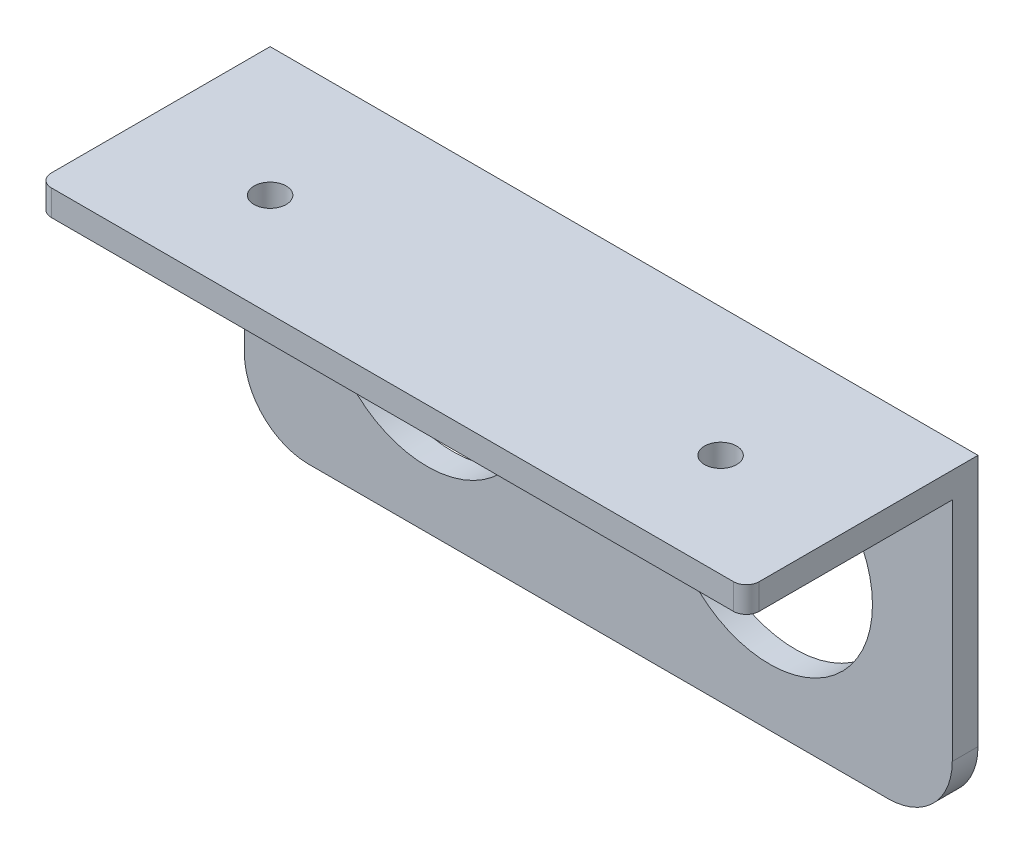
from build123d import *

# Parameters (mm, degrees)
SKETCH1_W             = 55
SKETCH1_H             = 22.6
BOSS_EXTRUDE1_DEPTH   = 2
SKETCH2_R             = 8
CUT_EXTRUDE2_DEPTH    = 2
SKETCH2_4_R           = 8
CUT_EXTRUDE3_DEPTH    = 2
SKETCH5_W             = 10
SKETCH5_H             = 4.7
CUT_EXTRUDE4_DEPTH    = 2
SKETCH6_W             = 55
SKETCH6_H             = 2
BOSS_EXTRUDE2_DEPTH   = 18
M3X0_5_TAPPED_HOLE1_D = 2.5
M3X0_5_TAPPED_HOLE2_D = 2.5
FILLET1_R             = 5
FILLET2_R             = 5
FILLET4_R             = 1.8
FILLET5_R             = 1.8
FILLET10_R            = 1


with BuildPart() as part:
    # Sketch1 → Boss-Extrude1 (new body)
    with BuildSketch(Plane.XY):
        with Locations((-1.071942446, 12.368165468)):
            Rectangle(SKETCH1_W, SKETCH1_H)
    extrude(amount=BOSS_EXTRUDE1_DEPTH)

    # Sketch2 → Cut-Extrude2 (cut)
    with BuildSketch(Plane.XY.offset(2)):
        with Locations((-14.371942446, 13.518165468)):
            Circle(SKETCH2_R)
    extrude(amount=-CUT_EXTRUDE2_DEPTH, mode=Mode.SUBTRACT)

    # Sketch2<4> → Cut-Extrude3 (cut)
    with BuildSketch(Plane.XY.offset(2)):
        with Locations((-14.371942446, 13.518165468)):
            Circle(SKETCH2_4_R)
        with Locations((12.228057554, 13.518165468)):
            Circle(SKETCH2_4_R)
    extrude(amount=-CUT_EXTRUDE3_DEPTH, mode=Mode.SUBTRACT)

    # Sketch5 → Cut-Extrude4 (cut)
    with BuildSketch(Plane.XY.offset(2)):
        with Locations((-1.171942446, 21.318165468)):
            Rectangle(SKETCH5_W, SKETCH5_H)
    extrude(amount=-CUT_EXTRUDE4_DEPTH, mode=Mode.SUBTRACT)

    # Sketch6 → Boss-Extrude2 (add)
    with BuildSketch(Plane(origin=(0, 0, 0), x_dir=(-1, 0, 0), z_dir=(0, 0, -1))):
        with Locations((1.071942446, 24.668165468)):
            Rectangle(SKETCH6_W, SKETCH6_H)
    extrude(amount=-BOSS_EXTRUDE2_DEPTH)

    # M3x0.5 Tapped Hole1 (through all)
    with Locations(Plane(origin=(0, 23.668165468, 0), x_dir=(-1, 0, 0), z_dir=(0, -1, 0))):
        with Locations((-16.428057554, -10)):
            Hole(M3X0_5_TAPPED_HOLE1_D / 2)

    # M3x0.5 Tapped Hole2 (through all)
    with Locations(Plane(origin=(0, 23.668165468, 0), x_dir=(-1, 0, 0), z_dir=(0, -1, 0))):
        with Locations((18.571942446, -10)):
            Hole(M3X0_5_TAPPED_HOLE2_D / 2)

    # Fillet1
    fillet1_edges = [part.edges().sort_by_distance(p)[0] for p in [
        (-28.571942446, 1.068165468, 1),
    ]]
    fillet(fillet1_edges, radius=FILLET1_R)

    # Fillet2
    fillet2_edges = [part.edges().sort_by_distance(p)[0] for p in [
        (26.428057554, 1.068165468, 1),
    ]]
    fillet(fillet2_edges, radius=FILLET2_R)

    # Fillet4
    fillet4_edges = [part.edges().sort_by_distance(p)[0] for p in [
        (3.828057554, 18.968165468, 1),
    ]]
    fillet(fillet4_edges, radius=FILLET4_R)

    # Fillet5
    fillet5_edges = [part.edges().sort_by_distance(p)[0] for p in [
        (-6.171942446, 18.968165468, 1),
    ]]
    fillet(fillet5_edges, radius=FILLET5_R)

    # Fillet10
    fillet10_edges = [part.edges().sort_by_distance(p)[0] for p in [
        (26.428057554, 24.668165468, 18),
        (-28.571942446, 24.668165468, 18),
    ]]
    fillet(fillet10_edges, radius=FILLET10_R)


solid = part.part
